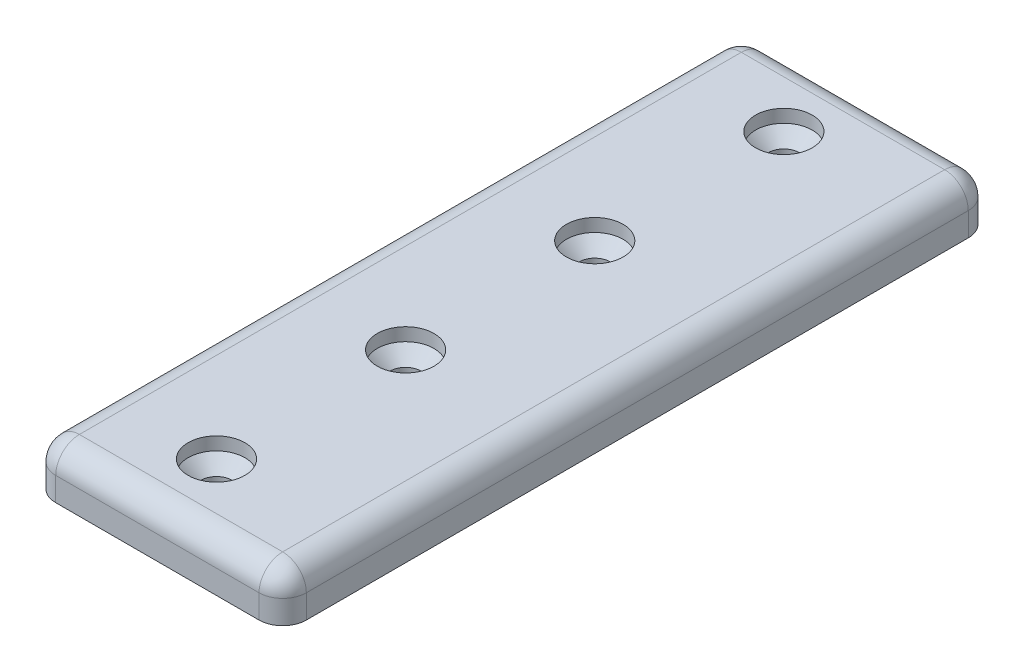
from build123d import *

# Parameters (mm, degrees)
SKETCH1_W               = 48
SKETCH1_H               = 48
SKETCH1_R               = 13.75
SKETCH1_H_2             = 10
BOSS_EXTRUDE1_DEPTH     = 230
SKETCH3_R               = 6
CUT_EXTRUDE1_DEPTH      = 0.5
SKETCH4_R               = 3.25
CUT_EXTRUDE2_DEPTH      = 240.26061105
CUT_EXTRUDE3_REACH      = 241.261
CUT_EXTRUDE3_END_RADIUS = 13.75
SKETCH5_R               = 6.5
CUT_EXTRUDE4_REACH      = 243.738
CUT_EXTRUDE4_END_RADIUS = 13.75
CUT_EXTRUDE4_START      = -5
CHAMFER1_SIZE           = 5
SKETCH8_W               = 230
SKETCH8_H               = 1.2
CUT_EXTRUDE5_DEPTH      = 10
SKETCH9_W               = 53
SKETCH9_H               = 80
CUT_EXTRUDE6_DEPTH      = 233.036635039
FILLET2_R               = 5


with BuildPart() as part:
    # Sketch1 → Boss-Extrude1 (new body)
    # profile 1 of 3: a face of its own
    with BuildSketch(Plane.XY):
        Rectangle(SKETCH1_W, SKETCH1_H)
        Circle(SKETCH1_R, mode=Mode.SUBTRACT)
    # profile 2 of 3: a face of its own
    with BuildSketch(Plane.XY):
        with Locations((0, 30.2)):
            Rectangle(SKETCH1_W, SKETCH1_H_2)
    # profile 3 of 3: a face of its own
    with BuildSketch(Plane.XY):
        Polygon((24, 24), (24, -24), (29, -24), (29, 35.2), (24, 35.2), (24, 25.2), align=None)
    extrude(amount=BOSS_EXTRUDE1_DEPTH)

    # Sketch3 → Cut-Extrude1 (cut)
    with BuildSketch(Plane(origin=(0, 35.2, 0), x_dir=(1, 0, 0), z_dir=(0, 1, 0))):
        with Locations(Location((0, -15, 0), (0, 0, 270))):
            Circle(SKETCH3_R)
        with Locations(Location((0, -55, 0), (0, 0, 270))):
            Circle(SKETCH3_R)
        with Locations(Location((0, -95, 0), (0, 0, 270))):
            Circle(SKETCH3_R)
        with Locations(Location((0, -135, 0), (0, 0, 270))):
            Circle(SKETCH3_R)
        with Locations(Location((0, -175, 0), (0, 0, 270))):
            Circle(SKETCH3_R)
        with Locations(Location((0, -215, 0), (0, 0, 270))):
            Circle(SKETCH3_R)
    extrude(amount=-CUT_EXTRUDE1_DEPTH, mode=Mode.SUBTRACT)

    # Sketch4 → Cut-Extrude2 (cut, through all)
    with BuildSketch(Plane(origin=(0, 35.2, 0), x_dir=(1, 0, 0), z_dir=(0, 1, 0))):
        with Locations(Location((0, -15, 0), (0, 0, 270))):
            Circle(SKETCH4_R)
        with Locations(Location((0, -55, 0), (0, 0, 270))):
            Circle(SKETCH4_R)
        with Locations(Location((0, -95, 0), (0, 0, 270))):
            Circle(SKETCH4_R)
        with Locations(Location((0, -135, 0), (0, 0, 270))):
            Circle(SKETCH4_R)
        with Locations(Location((0, -175, 0), (0, 0, 270))):
            Circle(SKETCH4_R)
        with Locations(Location((0, -215, 0), (0, 0, 270))):
            Circle(SKETCH4_R)
    extrude(amount=-CUT_EXTRUDE2_DEPTH, mode=Mode.SUBTRACT)

    # Cut-Extrude3: up to this cylinder (the profile starts outside it)
    cut_extrude3_end = Plane(origin=(0, 0, 115), z_dir=(0, 0, -1)) * Cylinder(CUT_EXTRUDE3_END_RADIUS, 711.022, mode=Mode.PRIVATE)
    # Sketch5 → Cut-Extrude3 (cut, up to the surface)
    with BuildSketch(Plane.XZ.offset(24), mode=Mode.PRIVATE) as cut_extrude3_sk1:
        with Locations(Location((0, 215, 0), (0, 0, 270))):
            Circle(SKETCH5_R)
    cut_extrude3_tool1 = extrude(cut_extrude3_sk1.sketch, amount=-CUT_EXTRUDE3_REACH, mode=Mode.PRIVATE) - cut_extrude3_end
    add(cut_extrude3_tool1.solids().sort_by_distance((0, -24, 215))[0], mode=Mode.SUBTRACT)
    # Sketch5 → Cut-Extrude3 (cut, up to the surface)
    with BuildSketch(Plane.XZ.offset(24), mode=Mode.PRIVATE) as cut_extrude3_sk2:
        with Locations(Location((0, 175, 0), (0, 0, 270))):
            Circle(SKETCH5_R)
    cut_extrude3_tool2 = extrude(cut_extrude3_sk2.sketch, amount=-CUT_EXTRUDE3_REACH, mode=Mode.PRIVATE) - cut_extrude3_end
    add(cut_extrude3_tool2.solids().sort_by_distance((0, -24, 175))[0], mode=Mode.SUBTRACT)
    # Sketch5 → Cut-Extrude3 (cut, up to the surface)
    with BuildSketch(Plane.XZ.offset(24), mode=Mode.PRIVATE) as cut_extrude3_sk3:
        with Locations(Location((0, 135, 0), (0, 0, 270))):
            Circle(SKETCH5_R)
    cut_extrude3_tool3 = extrude(cut_extrude3_sk3.sketch, amount=-CUT_EXTRUDE3_REACH, mode=Mode.PRIVATE) - cut_extrude3_end
    add(cut_extrude3_tool3.solids().sort_by_distance((0, -24, 135))[0], mode=Mode.SUBTRACT)
    # Sketch5 → Cut-Extrude3 (cut, up to the surface)
    with BuildSketch(Plane.XZ.offset(24), mode=Mode.PRIVATE) as cut_extrude3_sk4:
        with Locations(Location((0, 95, 0), (0, 0, 270))):
            Circle(SKETCH5_R)
    cut_extrude3_tool4 = extrude(cut_extrude3_sk4.sketch, amount=-CUT_EXTRUDE3_REACH, mode=Mode.PRIVATE) - cut_extrude3_end
    add(cut_extrude3_tool4.solids().sort_by_distance((0, -24, 95))[0], mode=Mode.SUBTRACT)
    # Sketch5 → Cut-Extrude3 (cut, up to the surface)
    with BuildSketch(Plane.XZ.offset(24), mode=Mode.PRIVATE) as cut_extrude3_sk5:
        with Locations(Location((0, 55, 0), (0, 0, 270))):
            Circle(SKETCH5_R)
    cut_extrude3_tool5 = extrude(cut_extrude3_sk5.sketch, amount=-CUT_EXTRUDE3_REACH, mode=Mode.PRIVATE) - cut_extrude3_end
    add(cut_extrude3_tool5.solids().sort_by_distance((0, -24, 55))[0], mode=Mode.SUBTRACT)
    # Sketch5 → Cut-Extrude3 (cut, up to the surface)
    with BuildSketch(Plane.XZ.offset(24), mode=Mode.PRIVATE) as cut_extrude3_sk6:
        with Locations(Location((0, 15, 0), (0, 0, 270))):
            Circle(SKETCH5_R)
    cut_extrude3_tool6 = extrude(cut_extrude3_sk6.sketch, amount=-CUT_EXTRUDE3_REACH, mode=Mode.PRIVATE) - cut_extrude3_end
    add(cut_extrude3_tool6.solids().sort_by_distance((0, -24, 15))[0], mode=Mode.SUBTRACT)

    # Cut-Extrude4: up to this cylinder (the profile starts outside it)
    cut_extrude4_end = Plane(origin=(0, 0, 115), z_dir=(0, 0, -1)) * Cylinder(CUT_EXTRUDE4_END_RADIUS, 715.976, mode=Mode.PRIVATE)
    # Sketch7 → Cut-Extrude4 (cut, up to the surface)
    with BuildSketch(Plane(origin=(0, 24, 0), x_dir=(1, 0, 0), z_dir=(0, 1, 0)).offset(CUT_EXTRUDE4_START), mode=Mode.PRIVATE) as cut_extrude4_sk1:
        Polygon((0, -8.533676985), (-5.6, -11.766838493), (-5.6, -18.233161507), (0, -21.466323015), (5.6, -18.233161507), (5.6, -11.766838493), align=None)
    cut_extrude4_tool1 = extrude(cut_extrude4_sk1.sketch, amount=-CUT_EXTRUDE4_REACH, mode=Mode.PRIVATE) - cut_extrude4_end
    add(cut_extrude4_tool1.solids().sort_by_distance((0, 19, 15))[0], mode=Mode.SUBTRACT)
    # Sketch7 → Cut-Extrude4 (cut, up to the surface)
    with BuildSketch(Plane(origin=(0, 24, 0), x_dir=(1, 0, 0), z_dir=(0, 1, 0)).offset(CUT_EXTRUDE4_START), mode=Mode.PRIVATE) as cut_extrude4_sk2:
        Polygon((0, -48.533676985), (-5.6, -51.766838493), (-5.6, -58.233161507), (0, -61.466323015), (5.6, -58.233161507), (5.6, -51.766838493), align=None)
    cut_extrude4_tool2 = extrude(cut_extrude4_sk2.sketch, amount=-CUT_EXTRUDE4_REACH, mode=Mode.PRIVATE) - cut_extrude4_end
    add(cut_extrude4_tool2.solids().sort_by_distance((0, 19, 55))[0], mode=Mode.SUBTRACT)
    # Sketch7 → Cut-Extrude4 (cut, up to the surface)
    with BuildSketch(Plane(origin=(0, 24, 0), x_dir=(1, 0, 0), z_dir=(0, 1, 0)).offset(CUT_EXTRUDE4_START), mode=Mode.PRIVATE) as cut_extrude4_sk3:
        Polygon((0, -88.533676985), (-5.6, -91.766838493), (-5.6, -98.233161507), (0, -101.466323015), (5.6, -98.233161507), (5.6, -91.766838493), align=None)
    cut_extrude4_tool3 = extrude(cut_extrude4_sk3.sketch, amount=-CUT_EXTRUDE4_REACH, mode=Mode.PRIVATE) - cut_extrude4_end
    add(cut_extrude4_tool3.solids().sort_by_distance((0, 19, 95))[0], mode=Mode.SUBTRACT)
    # Sketch7 → Cut-Extrude4 (cut, up to the surface)
    with BuildSketch(Plane(origin=(0, 24, 0), x_dir=(1, 0, 0), z_dir=(0, 1, 0)).offset(CUT_EXTRUDE4_START), mode=Mode.PRIVATE) as cut_extrude4_sk4:
        Polygon((0, -128.533676985), (-5.6, -131.766838493), (-5.6, -138.233161507), (0, -141.466323015), (5.6, -138.233161507), (5.6, -131.766838493), align=None)
    cut_extrude4_tool4 = extrude(cut_extrude4_sk4.sketch, amount=-CUT_EXTRUDE4_REACH, mode=Mode.PRIVATE) - cut_extrude4_end
    add(cut_extrude4_tool4.solids().sort_by_distance((0, 19, 135))[0], mode=Mode.SUBTRACT)
    # Sketch7 → Cut-Extrude4 (cut, up to the surface)
    with BuildSketch(Plane(origin=(0, 24, 0), x_dir=(1, 0, 0), z_dir=(0, 1, 0)).offset(CUT_EXTRUDE4_START), mode=Mode.PRIVATE) as cut_extrude4_sk5:
        Polygon((0, -168.533676985), (-5.6, -171.766838493), (-5.6, -178.233161507), (0, -181.466323015), (5.6, -178.233161507), (5.6, -171.766838493), align=None)
    cut_extrude4_tool5 = extrude(cut_extrude4_sk5.sketch, amount=-CUT_EXTRUDE4_REACH, mode=Mode.PRIVATE) - cut_extrude4_end
    add(cut_extrude4_tool5.solids().sort_by_distance((0, 19, 175))[0], mode=Mode.SUBTRACT)
    # Sketch7 → Cut-Extrude4 (cut, up to the surface)
    with BuildSketch(Plane(origin=(0, 24, 0), x_dir=(1, 0, 0), z_dir=(0, 1, 0)).offset(CUT_EXTRUDE4_START), mode=Mode.PRIVATE) as cut_extrude4_sk6:
        Polygon((0, -208.533676985), (-5.6, -211.766838493), (-5.6, -218.233161507), (0, -221.466323015), (5.6, -218.233161507), (5.6, -211.766838493), align=None)
    cut_extrude4_tool6 = extrude(cut_extrude4_sk6.sketch, amount=-CUT_EXTRUDE4_REACH, mode=Mode.PRIVATE) - cut_extrude4_end
    add(cut_extrude4_tool6.solids().sort_by_distance((0, 19, 215))[0], mode=Mode.SUBTRACT)

    # Chamfer1
    # the kernel refuses this chamfer: 5 mm, written as the material it takes off along each edge
    with BuildSketch(Plane(origin=(0, 34.7, 215), x_dir=(0, 0, 1), z_dir=(-1, 0, 0))) as chamfer1_piece_1_section:
        Polygon((3.25, -CHAMFER1_SIZE), (3.25 + CHAMFER1_SIZE, 0), (3.25, 0), align=None)
    chamfer1_piece_1 = revolve(axis=Axis((0, 34.7, 215), (0, 1, 0)), mode=Mode.PRIVATE)
    chamfer1_piece_1 = chamfer1_piece_1 & Plane(origin=(0, 31.051548399, 215), x_dir=(0, 0, 1), z_dir=(0, 1, 0)) * Cylinder(6, 33, mode=Mode.PRIVATE)
    add(chamfer1_piece_1, mode=Mode.SUBTRACT)
    with BuildSketch(Plane(origin=(0, 34.7, 175), x_dir=(0, 0, 1), z_dir=(-1, 0, 0))) as chamfer1_piece_2_section:
        Polygon((3.25, -CHAMFER1_SIZE), (3.25 + CHAMFER1_SIZE, 0), (3.25, 0), align=None)
    chamfer1_piece_2 = revolve(axis=Axis((0, 34.7, 175), (0, 1, 0)), mode=Mode.PRIVATE)
    chamfer1_piece_2 = chamfer1_piece_2 & Plane(origin=(0, 31.051548399, 175), x_dir=(0, 0, 1), z_dir=(0, 1, 0)) * Cylinder(6, 33, mode=Mode.PRIVATE)
    add(chamfer1_piece_2, mode=Mode.SUBTRACT)
    with BuildSketch(Plane(origin=(0, 34.7, 135), x_dir=(0, 0, 1), z_dir=(-1, 0, 0))) as chamfer1_piece_3_section:
        Polygon((3.25, -CHAMFER1_SIZE), (3.25 + CHAMFER1_SIZE, 0), (3.25, 0), align=None)
    chamfer1_piece_3 = revolve(axis=Axis((0, 34.7, 135), (0, 1, 0)), mode=Mode.PRIVATE)
    chamfer1_piece_3 = chamfer1_piece_3 & Plane(origin=(0, 31.051548399, 135), x_dir=(0, 0, 1), z_dir=(0, 1, 0)) * Cylinder(6, 33, mode=Mode.PRIVATE)
    add(chamfer1_piece_3, mode=Mode.SUBTRACT)
    with BuildSketch(Plane(origin=(0, 34.7, 95), x_dir=(0, 0, 1), z_dir=(-1, 0, 0))) as chamfer1_piece_4_section:
        Polygon((3.25, -CHAMFER1_SIZE), (3.25 + CHAMFER1_SIZE, 0), (3.25, 0), align=None)
    chamfer1_piece_4 = revolve(axis=Axis((0, 34.7, 95), (0, 1, 0)), mode=Mode.PRIVATE)
    chamfer1_piece_4 = chamfer1_piece_4 & Plane(origin=(0, 31.051548399, 95), x_dir=(0, 0, 1), z_dir=(0, 1, 0)) * Cylinder(6, 33, mode=Mode.PRIVATE)
    add(chamfer1_piece_4, mode=Mode.SUBTRACT)
    with BuildSketch(Plane(origin=(0, 34.7, 55), x_dir=(0, 0, 1), z_dir=(-1, 0, 0))) as chamfer1_piece_5_section:
        Polygon((3.25, -CHAMFER1_SIZE), (3.25 + CHAMFER1_SIZE, 0), (3.25, 0), align=None)
    chamfer1_piece_5 = revolve(axis=Axis((0, 34.7, 55), (0, 1, 0)), mode=Mode.PRIVATE)
    chamfer1_piece_5 = chamfer1_piece_5 & Plane(origin=(0, 31.051548399, 55), x_dir=(0, 0, 1), z_dir=(0, 1, 0)) * Cylinder(6, 33, mode=Mode.PRIVATE)
    add(chamfer1_piece_5, mode=Mode.SUBTRACT)
    with BuildSketch(Plane(origin=(0, 34.7, 15), x_dir=(0, 0, 1), z_dir=(-1, 0, 0))) as chamfer1_piece_6_section:
        Polygon((3.25, -CHAMFER1_SIZE), (3.25 + CHAMFER1_SIZE, 0), (3.25, 0), align=None)
    chamfer1_piece_6 = revolve(axis=Axis((0, 34.7, 15), (0, 1, 0)), mode=Mode.PRIVATE)
    chamfer1_piece_6 = chamfer1_piece_6 & Plane(origin=(0, 31.051548399, 15), x_dir=(0, 0, 1), z_dir=(0, 1, 0)) * Cylinder(6, 33, mode=Mode.PRIVATE)
    add(chamfer1_piece_6, mode=Mode.SUBTRACT)

    # Sketch8 → Cut-Extrude5 (cut)
    with BuildSketch(Plane.ZY.offset(-24)):
        with Locations((115, 24.6)):
            Rectangle(SKETCH8_W, SKETCH8_H)
    extrude(amount=-CUT_EXTRUDE5_DEPTH, mode=Mode.SUBTRACT)


with BuildPart() as body_2:
    # of the pieces the cut leaves, the one that is kept (cut_extrude5_keep)
    add(part.part.solids().sort_by_distance((29, 25.2, 0))[0])

    # Sketch9 → Cut-Extrude6 (cut, through all)
    with BuildSketch(Plane(origin=(0, 35.2, 0), x_dir=(1, 0, 0), z_dir=(0, 1, 0))):
        with Locations((2.5, -190)):
            Rectangle(SKETCH9_W, SKETCH9_H)
    extrude(amount=-CUT_EXTRUDE6_DEPTH, mode=Mode.SUBTRACT)

    # Fillet2
    fillet2_edges = [body_2.edges().sort_by_distance(p)[0] for p in [
        (29, 30.2, 0),
        (-24, 30.2, 0),
        (2.5, 35.2, 0),
        (-24, 35.2, 75),
        (29, 35.2, 75),
        (2.5, 35.2, 150),
        (-24, 30.2, 150),
        (29, 30.2, 150),
    ]]
    fillet(fillet2_edges, radius=FILLET2_R)


solid = body_2.part
